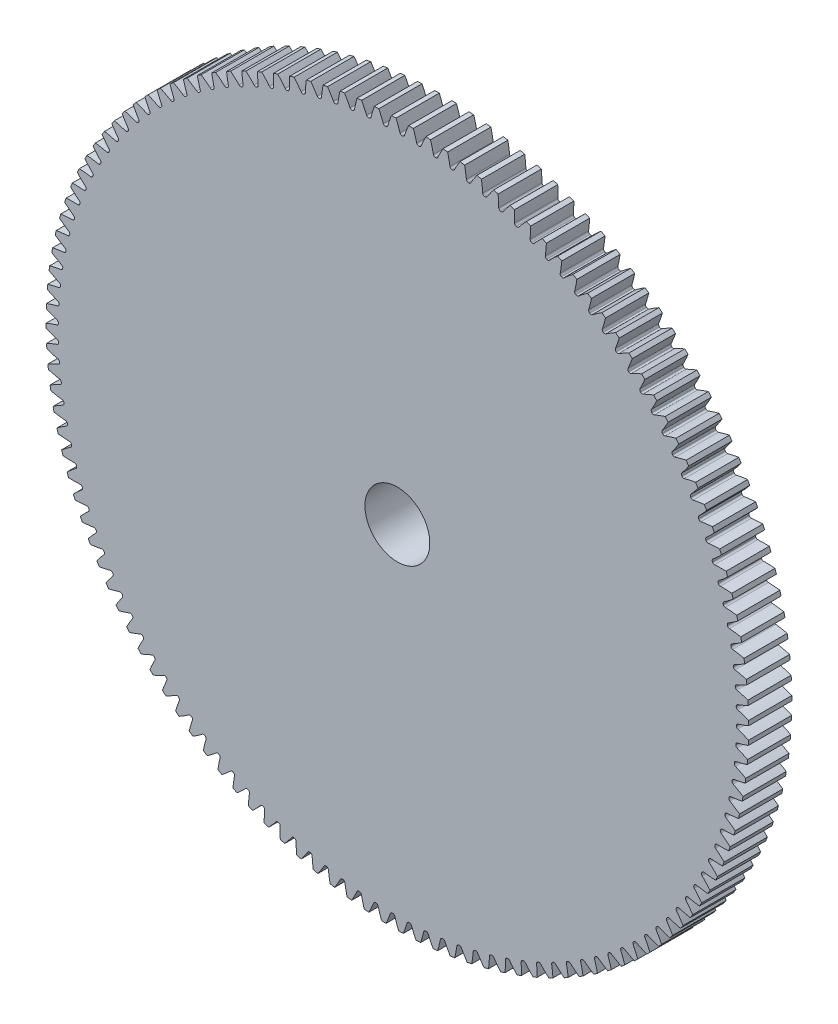
from build123d import *

# Parameters (mm, degrees)
SKETCH3_R                    = 51.59375
GEARBODY_DEPTH               = 6.35
TOOTHCUT_DEPTH               = 74.240375328
CIRPATTERN1_COUNT            = 128
BOREDIA_R                    = 1.5875
BORE_DEPTH                   = 12700
BOSS_EXTRUDE1_DEPTH          = 19.05
F_3_8_0_375_DIAMETER_HOLE1_D = 9.525


with BuildPart() as part:
    # Sketch3 → gearBody (new body)
    with BuildSketch(Plane.XY):
        Circle(SKETCH3_R)
    extrude(amount=GEARBODY_DEPTH)

    # Sketch2 → toothCut (cut, through all)
    with BuildSketch(Plane.XY):
        with BuildLine():
            ThreePointArc((49.791128573, -0.744880041), (49.791669175, -0.707821777), (49.792182195, -0.670763122))
            ThreePointArc((49.792182195, -0.670763122), (49.85206095, -0.493754461), (50.00423691, -0.385310888))
            ThreePointArc((50.00423691, -0.385310888), (55.775785838, 2.567286461), (60.26561802, 7.243825258))
            ThreePointArc((60.26561802, 7.243825258), (60.693272312, -0.862795335), (60.035355364, -8.953983809))
            ThreePointArc((60.035355364, -8.953983809), (55.680270843, -4.151708623), (49.994983452, -1.036244707))
            ThreePointArc((49.994983452, -1.036244707), (49.845951557, -0.923519263), (49.791128573, -0.744880041))
        make_face()
    toothcut = extrude(amount=TOOTHCUT_DEPTH, mode=Mode.SUBTRACT)

    # CirPattern1: toothCut ×128 about axis
    cirpattern1_axis = Axis((0, 0, 6.35), (0, 0, -1))
    for i in range(1, CIRPATTERN1_COUNT):
        add(toothcut.rotate(cirpattern1_axis, i * 360 / CIRPATTERN1_COUNT), mode=Mode.SUBTRACT)

    # boreDia → bore (cut, symmetric)
    with BuildSketch(Plane.XY):
        Circle(BOREDIA_R)
    extrude(amount=BORE_DEPTH, both=True, mode=Mode.SUBTRACT)

    # Sketch4 → Boss-Extrude1 (add)
    with BuildSketch(Plane(origin=(0, 0, 0), x_dir=(-1, 0, 0), z_dir=(0, 0, -1))):
        with BuildLine():
            ThreePointArc((-0.793738718, -8.16556784), (-0.707556317, -9.722715611), (-2e-09, -11.1125))
            ThreePointArc((-2e-09, -11.1125), (0.544212203, -11.099166154), (1.087118411, -11.059196617))
            ThreePointArc((1.087118411, -11.059196617), (1.655320364, -9.606859491), (1.588756053, -8.048749809))
            ThreePointArc((1.588756053, -8.048749809), (1.653196164, -7.581580176), (2.026164667, -7.292972328))
            ThreePointArc((2.026164667, -7.292972328), (2.314757883, -7.206572318), (2.599684553, -7.108757195))
            ThreePointArc((2.599684553, -7.108757195), (3.0709551, -7.126194658), (3.395386027, -7.468458545))
            ThreePointArc((3.395386027, -7.468458545), (4.24859606, -8.773896871), (5.556249998, -9.6237073))
            ThreePointArc((5.556249998, -9.6237073), (6.02088467, -9.340053749), (6.471070469, -9.03398601))
            ThreePointArc((6.471070469, -9.03398601), (6.236979233, -7.492124188), (5.400278009, -6.176043777))
            ThreePointArc((5.400278009, -6.176043777), (5.222499965, -5.739242951), (5.401196239, -5.302816972))
            ThreePointArc((5.401196239, -5.302816972), (5.607925289, -5.083695761), (5.805771462, -4.856522045))
            ThreePointArc((5.805771462, -4.856522045), (6.222622459, -4.635988057), (6.674719827, -4.770181814))
            ThreePointArc((6.674719827, -4.770181814), (8.066340554, -5.474119551), (9.623707298, -5.556250002))
            ThreePointArc((9.623707298, -5.556250002), (9.884265952, -5.078281485), (10.121104421, -4.588126147))
            ThreePointArc((10.121104421, -4.588126147), (9.147444552, -3.369880258), (7.764799831, -2.648471801))
            ThreePointArc((7.764799831, -2.648471801), (7.392439116, -2.359080211), (7.328981639, -1.89177609))
            ThreePointArc((7.328981639, -1.89177609), (7.398453644, -1.598647029), (7.456206597, -1.302985733))
            ThreePointArc((7.456206597, -1.302985733), (7.706943157, -0.903572198), (8.16556784, -0.793738718))
            ThreePointArc((8.16556784, -0.793738718), (9.722715611, -0.707556317), (11.1125, -2e-09))
            ThreePointArc((11.1125, -2e-09), (11.099166154, 0.544212203), (11.059196617, 1.087118411))
            ThreePointArc((11.059196617, 1.087118411), (9.606859491, 1.655320365), (8.048749811, 1.588756055))
            ThreePointArc((8.048749811, 1.588756055), (7.581580177, 1.653196165), (7.292972328, 2.026164667))
            ThreePointArc((7.292972328, 2.026164667), (7.206572318, 2.314757883), (7.108757195, 2.599684553))
            ThreePointArc((7.108757195, 2.599684553), (7.126194658, 3.0709551), (7.468458545, 3.395386026))
            ThreePointArc((7.468458545, 3.395386026), (8.773896871, 4.24859606), (9.6237073, 5.556249998))
            ThreePointArc((9.6237073, 5.556249998), (9.340053749, 6.02088467), (9.03398601, 6.471070469))
            ThreePointArc((9.03398601, 6.471070469), (7.492124188, 6.236979233), (6.176043777, 5.400278009))
            ThreePointArc((6.176043777, 5.400278009), (5.739242952, 5.222499965), (5.302816972, 5.401196238))
            ThreePointArc((5.302816972, 5.401196238), (5.08369576, 5.60792529), (4.856522043, 5.805771463))
            ThreePointArc((4.856522043, 5.805771463), (4.635988055, 6.222622461), (4.770181812, 6.674719828))
            ThreePointArc((4.770181812, 6.674719828), (5.474119549, 8.066340556), (5.55625, 9.6237073))
            ThreePointArc((5.55625, 9.6237073), (5.078281484, 9.884265953), (4.588126147, 10.121104421))
            ThreePointArc((4.588126147, 10.121104421), (3.369880258, 9.147444552), (2.648471801, 7.764799831))
            ThreePointArc((2.648471801, 7.764799831), (2.359080211, 7.392439116), (1.89177609, 7.328981639))
            ThreePointArc((1.89177609, 7.328981639), (1.598647029, 7.398453644), (1.302985733, 7.456206597))
            ThreePointArc((1.302985733, 7.456206597), (0.903572197, 7.706943157), (0.793738716, 8.165567841))
            ThreePointArc((0.793738716, 8.165567841), (0.707556315, 9.722715612), (0, 11.112500001))
            ThreePointArc((0, 11.112500001), (-0.544212204, 11.099166155), (-1.087118411, 11.059196618))
            ThreePointArc((-1.087118411, 11.059196618), (-1.655320366, 9.606859493), (-1.588756057, 8.048749812))
            ThreePointArc((-1.588756057, 8.048749812), (-1.653196166, 7.581580178), (-2.026164669, 7.292972329))
            ThreePointArc((-2.026164669, 7.292972329), (-2.314757885, 7.20657232), (-2.599684555, 7.108757197))
            ThreePointArc((-2.599684555, 7.108757197), (-3.070955102, 7.12619466), (-3.395386029, 7.468458547))
            ThreePointArc((-3.395386029, 7.468458547), (-4.248596062, 8.773896873), (-5.55625, 9.623707302))
            ThreePointArc((-5.55625, 9.623707302), (-6.020884671, 9.340053751), (-6.471070471, 9.033986012))
            ThreePointArc((-6.471070471, 9.033986012), (-6.236979234, 7.49212419), (-5.40027801, 6.176043779))
            ThreePointArc((-5.40027801, 6.176043779), (-5.222499966, 5.739242953), (-5.40119624, 5.302816973))
            ThreePointArc((-5.40119624, 5.302816973), (-5.607925292, 5.083695762), (-5.805771465, 4.856522044))
            ThreePointArc((-5.805771465, 4.856522044), (-6.222622462, 4.635988058), (-6.674719829, 4.770181815))
            ThreePointArc((-6.674719829, 4.770181815), (-8.066340556, 5.474119552), (-9.6237073, 5.556250003))
            ThreePointArc((-9.6237073, 5.556250003), (-9.884265953, 5.078281486), (-10.121104423, 4.588126148))
            ThreePointArc((-10.121104423, 4.588126148), (-9.147444554, 3.36988026), (-7.764799834, 2.648471803))
            ThreePointArc((-7.764799834, 2.648471803), (-7.392439117, 2.359080214), (-7.32898164, 1.891776091))
            ThreePointArc((-7.32898164, 1.891776091), (-7.398453645, 1.59864703), (-7.456206599, 1.302985733))
            ThreePointArc((-7.456206599, 1.302985733), (-7.706943158, 0.903572199), (-8.165567841, 0.793738718))
            ThreePointArc((-8.165567841, 0.793738718), (-9.722715612, 0.707556317), (-11.112500001, 2e-09))
            ThreePointArc((-11.112500001, 2e-09), (-11.099166155, -0.544212203), (-11.059196618, -1.087118411))
            ThreePointArc((-11.059196618, -1.087118411), (-9.606859492, -1.655320365), (-8.048749812, -1.588756055))
            ThreePointArc((-8.048749812, -1.588756055), (-7.581580178, -1.653196165), (-7.292972329, -2.026164667))
            ThreePointArc((-7.292972329, -2.026164667), (-7.206572319, -2.314757883), (-7.108757196, -2.599684553))
            ThreePointArc((-7.108757196, -2.599684553), (-7.126194659, -3.070955101), (-7.468458546, -3.395386027))
            ThreePointArc((-7.468458546, -3.395386027), (-8.773896873, -4.248596061), (-9.623707302, -5.556249998))
            ThreePointArc((-9.623707302, -5.556249998), (-9.34005375, -6.02088467), (-9.033986011, -6.47107047))
            ThreePointArc((-9.033986011, -6.47107047), (-7.492124189, -6.236979233), (-6.176043778, -5.40027801))
            ThreePointArc((-6.176043778, -5.40027801), (-5.739242952, -5.222499965), (-5.302816972, -5.401196239))
            ThreePointArc((-5.302816972, -5.401196239), (-5.083695762, -5.60792529), (-4.856522046, -5.805771463))
            ThreePointArc((-4.856522046, -5.805771463), (-4.635988057, -6.22262246), (-4.770181814, -6.674719827))
            ThreePointArc((-4.770181814, -6.674719827), (-5.474119551, -8.066340555), (-5.556250002, -9.623707298))
            ThreePointArc((-5.556250002, -9.623707298), (-5.078281485, -9.884265952), (-4.588126147, -10.121104421))
            ThreePointArc((-4.588126147, -10.121104421), (-3.369880259, -9.147444552), (-2.648471802, -7.764799832))
            ThreePointArc((-2.648471802, -7.764799832), (-2.359080213, -7.392439116), (-1.89177609, -7.328981639))
            ThreePointArc((-1.89177609, -7.328981639), (-1.59864703, -7.398453643), (-1.302985735, -7.456206597))
            ThreePointArc((-1.302985735, -7.456206597), (-0.903572199, -7.706943156), (-0.793738718, -8.16556784))
        make_face()
    extrude(amount=BOSS_EXTRUDE1_DEPTH)

    # 3/8 (0.375) Diameter Hole1 (through all)
    with Locations(Plane(origin=(0, 0, -19.05), x_dir=(-1, 0, 0), z_dir=(0, 0, -1))):
        with Locations((0, 0)):
            Hole(F_3_8_0_375_DIAMETER_HOLE1_D / 2)


solid = part.part
